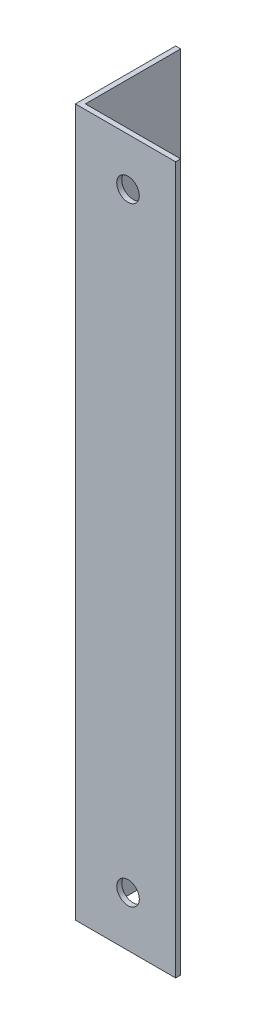
from build123d import *

# Parameters (mm, degrees)
EXTRUDE_1_DEPTH     = 141
SKETCH_2_R          = 2.25
CUT_EXTRUDE_1_DEPTH = 144.673240376


with BuildPart() as part:
    # Эскиз1 → Бобышка-Вытянуть1 (new body)
    with BuildSketch(Plane(origin=(0, 0, 0), x_dir=(1, 0, 0), z_dir=(0, 1, 0))):
        Polygon((0, 0), (0, 20), (1, 20), (1, 1), (20, 1), (20, 0), align=None)
    extrude(amount=EXTRUDE_1_DEPTH)

    # Эскиз2 → Вырез-Вытянуть1 (cut, through all)
    with BuildSketch(Plane(origin=(0, 0, -1), x_dir=(-1, 0, 0), z_dir=(0, 0, -1))):
        with Locations((-10.5, 10)):
            Circle(SKETCH_2_R)
        with Locations((-10.5, 131.5)):
            Circle(SKETCH_2_R)
    extrude(amount=-CUT_EXTRUDE_1_DEPTH, mode=Mode.SUBTRACT)


solid = part.part
